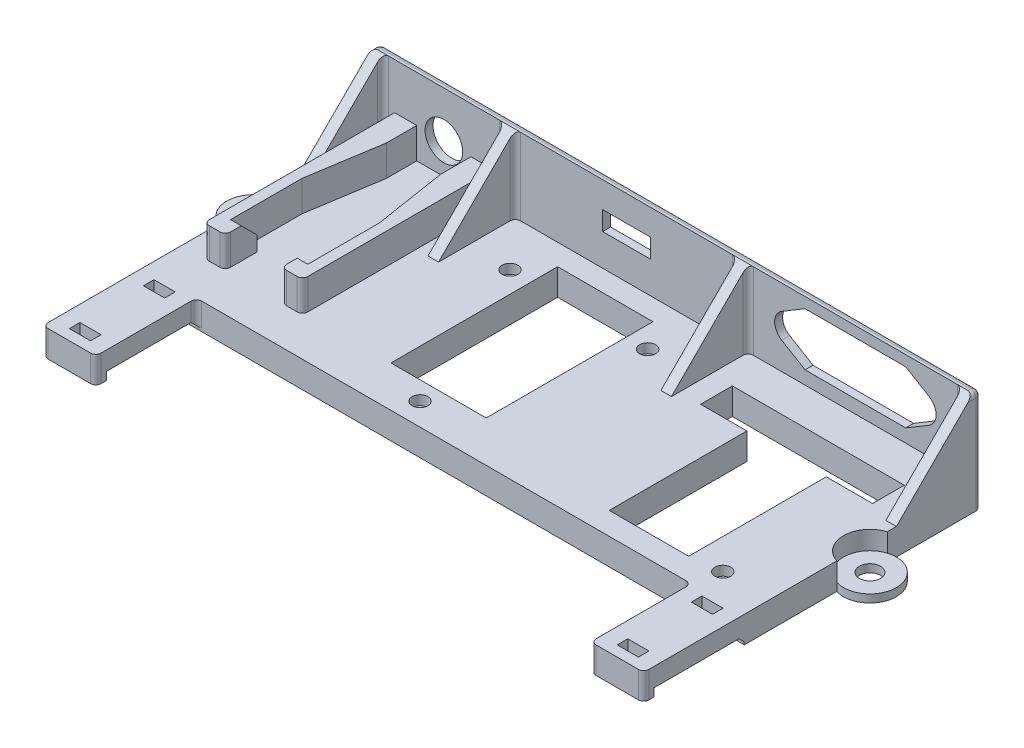
from build123d import *
from build123d.topology import SkipClean

# Parameters (mm, degrees)
SKETCH1_W                = 113.5
SKETCH1_H                = 14.5
SKETCH1_W_2              = 9
SKETCH1_H_2              = 3.6
SKETCH1_R                = 3.55
BOSS_EXTRUDE1_DEPTH      = 1.5
BOSS_EXTRUDE2_DEPTH      = 43.25
BOSS_EXTRUDE2_DEPTH_BACK = 1.5
SKETCH1_4_W              = 113.5
SKETCH1_4_H              = 5
SKETCH2_R                = 1.5
SKETCH2_W                = 18
SKETCH2_H                = 31.5
CUT_EXTRUDE1_DEPTH       = 123.323597478
BOSS_EXTRUDE3_DEPTH      = 5
SKETCH2_4_R              = 5
CUT_EXTRUDE2_DEPTH       = 3.5
CUT_EXTRUDE3_DEPTH       = 129.377616819
SKETCH1_5_W              = 2
SKETCH1_5_H              = 14.5
BOSS_EXTRUDE4_DEPTH      = 15
CHAMFER1_SIZE            = 15
BOSS_EXTRUDE5_DEPTH      = 5.8
BOSS_EXTRUDE6_DEPTH      = 3.5
BOSS_EXTRUDE7_DEPTH      = 5
SKETCH5_W                = 4
SKETCH5_H                = 12
CUT_EXTRUDE4_DEPTH       = 0.4
CHAMFER2_SIZE            = 1
CHAMFER3_SIZE            = 3
SKETCH6_R                = 3
CUT_EXTRUDE6_DEPTH       = 3
SKETCH7_R                = 2.883659138
SKETCH7_R_2              = 3
BOSS_EXTRUDE8_DEPTH      = 0.2
FILLET1_R                = 1


# Some blends are built 0.0001 mm under size
with BuildPart() as part:
    # Sketch1 → Boss-Extrude1 (new body)
    with BuildSketch(Plane.XY):
        with Locations((56.75, 7.25)):
            Rectangle(SKETCH1_W, SKETCH1_H)
        with Locations((48, 7.8)):
            Rectangle(SKETCH1_W_2, SKETCH1_H_2, mode=Mode.SUBTRACT)
        with Locations((13.5, 5.8)):
            Circle(SKETCH1_R, mode=Mode.SUBTRACT)
        with BuildLine():
            ThreePointArc((77.33789888, 5.140239328), (76, 7.5), (77.33789888, 9.859760672))
            Line((77.33789888, 9.859760672), (81.75, 12.5))
            Line((81.75, 12.5), (100.75, 12.5))
            Line((100.75, 12.5), (105.16210112, 9.859760672))
            ThreePointArc((105.16210112, 9.859760672), (106.5, 7.5), (105.16210112, 5.140239328))
            Line((105.16210112, 5.140239328), (100.75, 2.5))
            Line((100.75, 2.5), (81.75, 2.5))
            Line((81.75, 2.5), (77.33789888, 5.140239328))
        make_face(mode=Mode.SUBTRACT)
    extrude(amount=-BOSS_EXTRUDE1_DEPTH)

    # Sketch1<4> → Boss-Extrude2 (add, two sides: drawn at the far end of the back side and taken through both)
    with BuildSketch(Plane.XY.offset(-BOSS_EXTRUDE2_DEPTH_BACK)):
        with Locations((56.75, -2.5)):
            Rectangle(SKETCH1_4_W, SKETCH1_4_H)
    extrude(amount=BOSS_EXTRUDE2_DEPTH + BOSS_EXTRUDE2_DEPTH_BACK)

    # Sketch2 → Cut-Extrude1 (cut, through all)
    with BuildSketch(Plane(origin=(0, 0, 0), x_dir=(1, 0, 0), z_dir=(0, 1, 0))):
        with Locations(Location((35, -9, 0), (0, 0, 270))):
            Circle(SKETCH2_R)
        with Locations(Location((61, -9, 0), (0, 0, 270))):
            Circle(SKETCH2_R)
        with Locations((48, -19.75)):
            Rectangle(SKETCH2_W, SKETCH2_H)
        Polygon((75, -7), (75, -13), (83.75, -13), (83.75, -39), (98.75, -39), (98.75, -13), (107.5, -13), (107.5, -7), align=None)
        with Locations(Location((48, -39, 0), (0, 0, 270))):
            Circle(SKETCH2_R)
        with Locations(Location((104.5, -38.3, 0), (0, 0, 270))):
            Circle(SKETCH2_R)
    extrude(amount=-CUT_EXTRUDE1_DEPTH, mode=Mode.SUBTRACT)

    # Sketch2<3> → Boss-Extrude3 (add)
    with BuildSketch(Plane(origin=(0, 0, 0), x_dir=(1, 0, 0), z_dir=(0, 1, 0))):
        with BuildLine():
            Line((0, -19.677124344), (0, -16.230303993))
            ThreePointArc((0, -16.230303993), (-6.5, -21), (0, -25.769696007))
            Line((0, -25.769696007), (0, -22.322875656))
            ThreePointArc((0, -22.322875656), (-3.5, -21), (0, -19.677124344))
        make_face()
        with BuildLine():
            ThreePointArc((120, -21), (117.958039892, -16.968871126), (113.5, -16.230303993))
            Line((113.5, -16.230303993), (113.5, -19.677124344))
            ThreePointArc((113.5, -19.677124344), (115.707106781, -19.129171307), (117, -21))
            ThreePointArc((117, -21), (115.707106781, -22.870828693), (113.5, -22.322875656))
            Line((113.5, -22.322875656), (113.5, -25.769696007))
            ThreePointArc((113.5, -25.769696007), (117.958039892, -25.031128874), (120, -21))
        make_face()
    extrude(amount=-BOSS_EXTRUDE3_DEPTH)

    # Sketch2<4> → Cut-Extrude2 (cut)
    with BuildSketch(Plane(origin=(0, 0, 0), x_dir=(1, 0, 0), z_dir=(0, 1, 0))):
        with Locations((115, -21)):
            Circle(SKETCH2_4_R)
        with Locations((-1.5, -21)):
            Circle(SKETCH2_4_R)
    extrude(amount=-CUT_EXTRUDE2_DEPTH, mode=Mode.SUBTRACT)

    # Sketch2<5> → Cut-Extrude3 (cut, through all)
    with SkipClean():  # the faces are left unmerged after this step: merging them gives an invalid solid
        with BuildSketch(Plane(origin=(0, 0, 0), x_dir=(1, 0, 0), z_dir=(0, 1, 0))):
            with BuildLine():
                ThreePointArc((0, -22.322875656), (0.370828693, -21.707106781), (0.5, -21))
                Line((0.5, -21), (0, -21))
                Line((0, -21), (0, -22.322875656))
            make_face()
            with BuildLine():
                Line((0, -21), (0.5, -21))
                ThreePointArc((0.5, -21), (0.370828693, -20.292893219), (0, -19.677124344))
                Line((0, -19.677124344), (0, -21))
            make_face()
            with BuildLine():
                Line((0, -22.322875656), (0, -21))
                Line((0, -21), (0, -19.677124344))
                ThreePointArc((0, -19.677124344), (-3.5, -21), (0, -22.322875656))
            make_face()
            with BuildLine():
                ThreePointArc((113.5, -19.677124344), (113.129171307, -20.292893219), (113, -21))
                Line((113, -21), (113.5, -21))
                Line((113.5, -21), (113.5, -19.677124344))
            make_face()
            with BuildLine():
                Line((113.5, -21), (113, -21))
                ThreePointArc((113, -21), (113.129171307, -21.707106781), (113.5, -22.322875656))
                Line((113.5, -22.322875656), (113.5, -21))
            make_face()
            with BuildLine():
                Line((113.5, -19.677124344), (113.5, -21))
                Line((113.5, -21), (113.5, -22.322875656))
                ThreePointArc((113.5, -22.322875656), (115.707106781, -22.870828693), (117, -21))
                ThreePointArc((117, -21), (115.707106781, -19.129171307), (113.5, -19.677124344))
            make_face()
        extrude(amount=-CUT_EXTRUDE3_DEPTH, mode=Mode.SUBTRACT)

    # Sketch1<5> → Boss-Extrude4 (add)
    with SkipClean():  # the faces are left unmerged after this step: merging them gives an invalid solid
        with BuildSketch(Plane.XY):
            with Locations((1, 7.25)):
                Rectangle(SKETCH1_5_W, SKETCH1_5_H)
            with Locations((112.5, 7.25)):
                Rectangle(SKETCH1_5_W, SKETCH1_5_H)
            with Locations((26, 7.25)):
                Rectangle(SKETCH1_5_W, SKETCH1_5_H)
            with Locations((70, 7.25)):
                Rectangle(SKETCH1_5_W, SKETCH1_5_H)
        extrude(amount=BOSS_EXTRUDE4_DEPTH)

    # Chamfer1
    # the kernel refuses this chamfer: 15 mm, written as the material it takes off along each edge
    with BuildSketch(Plane(origin=(152.075244819, 14.5, 15), x_dir=(0, 0.02749587661058632, -0.9996219169112968), z_dir=(-1, 0, 0))) as chamfer1_piece_1_section:
        Polygon((CHAMFER1_SIZE * 0.999621916911, CHAMFER1_SIZE * 0.0274958766106), (-CHAMFER1_SIZE * 0.0274958766106, CHAMFER1_SIZE * 0.999621916911), (0, 0), align=None)
    chamfer1_piece_1 = extrude(amount=79.150489639, mode=Mode.PRIVATE)
    chamfer1_piece_1 = split(chamfer1_piece_1, bisect_by=Plane(origin=(112.5, 0, 10.024674218), z_dir=(0, 1, 0)), keep=Keep.TOP, mode=Mode.PRIVATE)
    add(chamfer1_piece_1, mode=Mode.SUBTRACT)
    with BuildSketch(Plane(origin=(30.424755181, 14.5, 15), x_dir=(0, 0.02749587661058632, -0.9996219169112968), z_dir=(1, 0, 0))) as chamfer1_piece_2_section:
        Polygon((CHAMFER1_SIZE * 0.999621916911, -CHAMFER1_SIZE * 0.0274958766106), (-CHAMFER1_SIZE * 0.0274958766106, -CHAMFER1_SIZE * 0.999621916911), (0, 0), align=None)
    chamfer1_piece_2 = extrude(amount=79.150489639, mode=Mode.PRIVATE)
    chamfer1_piece_2 = split(chamfer1_piece_2, bisect_by=Plane(origin=(70, 0, 10.024674218), z_dir=(0, 1, 0)), keep=Keep.TOP, mode=Mode.PRIVATE)
    add(chamfer1_piece_2, mode=Mode.SUBTRACT)
    with BuildSketch(Plane(origin=(65.575244819, 14.5, 15), x_dir=(0, 0.02749587661058632, -0.9996219169112968), z_dir=(-1, 0, 0))) as chamfer1_piece_3_section:
        Polygon((CHAMFER1_SIZE * 0.999621916911, CHAMFER1_SIZE * 0.0274958766106), (-CHAMFER1_SIZE * 0.0274958766106, CHAMFER1_SIZE * 0.999621916911), (0, 0), align=None)
    chamfer1_piece_3 = extrude(amount=79.150489639, mode=Mode.PRIVATE)
    chamfer1_piece_3 = split(chamfer1_piece_3, bisect_by=Plane(origin=(26, 0, 10.024674218), z_dir=(0, 1, 0)), keep=Keep.TOP, mode=Mode.PRIVATE)
    add(chamfer1_piece_3, mode=Mode.SUBTRACT)
    with BuildSketch(Plane(origin=(40.575244819, 14.5, 15), x_dir=(0, 0.02749587661058632, -0.9996219169112968), z_dir=(-1, 0, 0))) as chamfer1_piece_4_section:
        Polygon((CHAMFER1_SIZE * 0.999621916911, CHAMFER1_SIZE * 0.0274958766106), (-CHAMFER1_SIZE * 0.0274958766106, CHAMFER1_SIZE * 0.999621916911), (0, 0), align=None)
    chamfer1_piece_4 = extrude(amount=79.150489639, mode=Mode.PRIVATE)
    chamfer1_piece_4 = split(chamfer1_piece_4, bisect_by=Plane(origin=(1, 0, 10.024674218), z_dir=(0, 1, 0)), keep=Keep.TOP, mode=Mode.PRIVATE)
    add(chamfer1_piece_4, mode=Mode.SUBTRACT)

    # Sketch2<6> → Boss-Extrude5 (add)
    with BuildSketch(Plane(origin=(0, 0, 0), x_dir=(1, 0, 0), z_dir=(0, 1, 0))):
        Polygon((18.625, -5.75), (20.8, -19.5), (20.8, -30), (18.8, -30), (18.8, -36), (22.8, -36), (22.8, 0), (18.625, 0), align=None)
        Polygon((8.375, -5.75), (8.375, 0), (4.2, 0), (4.2, -36), (8.2, -36), (8.2, -30), (6.2, -30), (6.2, -19.5), align=None)
    extrude(amount=BOSS_EXTRUDE5_DEPTH)

    # Sketch4 → Boss-Extrude6 (add)
    # profile 1 of 2: a face of its own
    with BuildSketch(Plane(origin=(0, 0, 0), x_dir=(1, 0, 0), z_dir=(0, 1, 0))):
        Polygon((3, -58.25), (5, -58.25), (7, -58.25), (7, -60.25), (10, -60.25), (10, -43.25), (0, -43.25), (0, -60.25), (3, -60.25), align=None)
        Polygon((7, -46.25), (5, -46.25), (3, -46.25), (3, -44.25), (7, -44.25), align=None, mode=Mode.SUBTRACT)
    # profile 2 of 2: a face of its own
    with BuildSketch(Plane(origin=(0, 0, 0), x_dir=(1, 0, 0), z_dir=(0, 1, 0))):
        Polygon((113.5, -60.25), (113.5, -43.25), (103.5, -43.25), (103.5, -60.25), (106.5, -60.25), (106.5, -58.25), (108.5, -58.25), (110.5, -58.25), (110.5, -60.25), align=None)
        Polygon((110.5, -46.25), (108.5, -46.25), (106.5, -46.25), (106.5, -44.25), (110.5, -44.25), align=None, mode=Mode.SUBTRACT)
    extrude(amount=-BOSS_EXTRUDE6_DEPTH)

    # Sketch4<4> → Boss-Extrude7 (add)
    with BuildSketch(Plane(origin=(0, 0, 0), x_dir=(1, 0, 0), z_dir=(0, 1, 0))):
        Polygon((7, -60.25), (3, -60.25), (0, -60.25), (0, -62.25), (10, -62.25), (10, -60.25), align=None)
        Polygon((113.5, -62.25), (113.5, -60.25), (110.5, -60.25), (106.5, -60.25), (103.5, -60.25), (103.5, -62.25), align=None)
    extrude(amount=-BOSS_EXTRUDE7_DEPTH)

    # Sketch5 → Cut-Extrude4 (cut)
    with BuildSketch(Plane.XZ.offset(3.5)):
        with Locations((108.5, 52.25)):
            Rectangle(SKETCH5_W, SKETCH5_H)
        with Locations((5, 52.25)):
            Rectangle(SKETCH5_W, SKETCH5_H)
    extrude(amount=-CUT_EXTRUDE4_DEPTH, mode=Mode.SUBTRACT)

    # Chamfer2
    chamfer2_edges = [part.edges().sort_by_distance(p)[0] for p in [
        (5, -3.5, 43.25),
        (108.5, -3.5, 43.25),
    ]]
    chamfer(chamfer2_edges, length=CHAMFER2_SIZE - 0.0001)  # a hair under: the kernel refuses the full size

    # Chamfer3
    chamfer3_edges = [part.edges().sort_by_distance(p)[0] for p in [
        (7.2, 5.8, 30),
        (19.8, 5.8, 30),
    ]]
    chamfer(chamfer3_edges, length=CHAMFER3_SIZE)

    # Sketch6 → Cut-Extrude6 (cut)
    with BuildSketch(Plane.XZ.offset(5)):
        with Locations(Location((35, 9, 0), (0, 0, 270))):
            Circle(SKETCH6_R)
        with Locations(Location((61, 9, 0), (0, 0, 270))):
            Circle(SKETCH6_R)
        with Locations(Location((48, 39, 0), (0, 0, 270))):
            Circle(SKETCH6_R)
        with Locations(Location((104.5, 38.3, 0), (0, 0, 270))):
            Circle(SKETCH6_R)
    extrude(amount=-CUT_EXTRUDE6_DEPTH, mode=Mode.SUBTRACT)

    # Sketch7 → Boss-Extrude8 (add)
    with BuildSketch(Plane.XZ.offset(2)):
        with Locations((48, 39)):
            Circle(SKETCH7_R)
        with Locations(Location((35, 9, 0), (0, 0, 270))):
            Circle(SKETCH7_R_2)
        with Locations(Location((61, 9, 0), (0, 0, 270))):
            Circle(SKETCH7_R_2)
        with Locations(Location((104.5, 38.3, 0), (0, 0, 270))):
            Circle(SKETCH7_R_2)
    extrude(amount=-BOSS_EXTRUDE8_DEPTH)

    # Fillet1
    fillet1_edges = [part.edges().sort_by_distance(p)[0] for p in [
        (0, 14.5, -0.75),
        (113.5, 14.5, -0.75),
        (111.5, 7.25, 0),
        (69, 7.25, 0),
        (25, 7.25, 0),
        (71, 7.25, 0),
        (27, 7.25, 0),
        (2, 7.25, 0),
        (56.75, -5, -1.5),
        (56.75, 14.5, -1.5),
        (113.5, 4.75, -1.5),
        (0, 4.75, -1.5),
        (103.5, -2.24995, 43.25),
        (103.5, -2.5, 62.25),
        (113.5, -2.5, 62.25),
        (10, -2.24995, 43.25),
        (10, -2.5, 62.25),
        (0, -2.5, 62.25),
        (18.8, 2.9, 36),
        (8.2, 2.9, 36),
        (4.2, 2.9, 36),
        (22.8, 2.9, 36),
        (108.5, -3.1, 58.25),
        (108.5, -3.1, 46.25),
        (5, -3.1, 58.25),
        (5, -3.1, 46.25),
    ]]
    fillet(fillet1_edges, radius=FILLET1_R - 0.0001)  # a hair under: the kernel refuses the full size


solid = part.part
